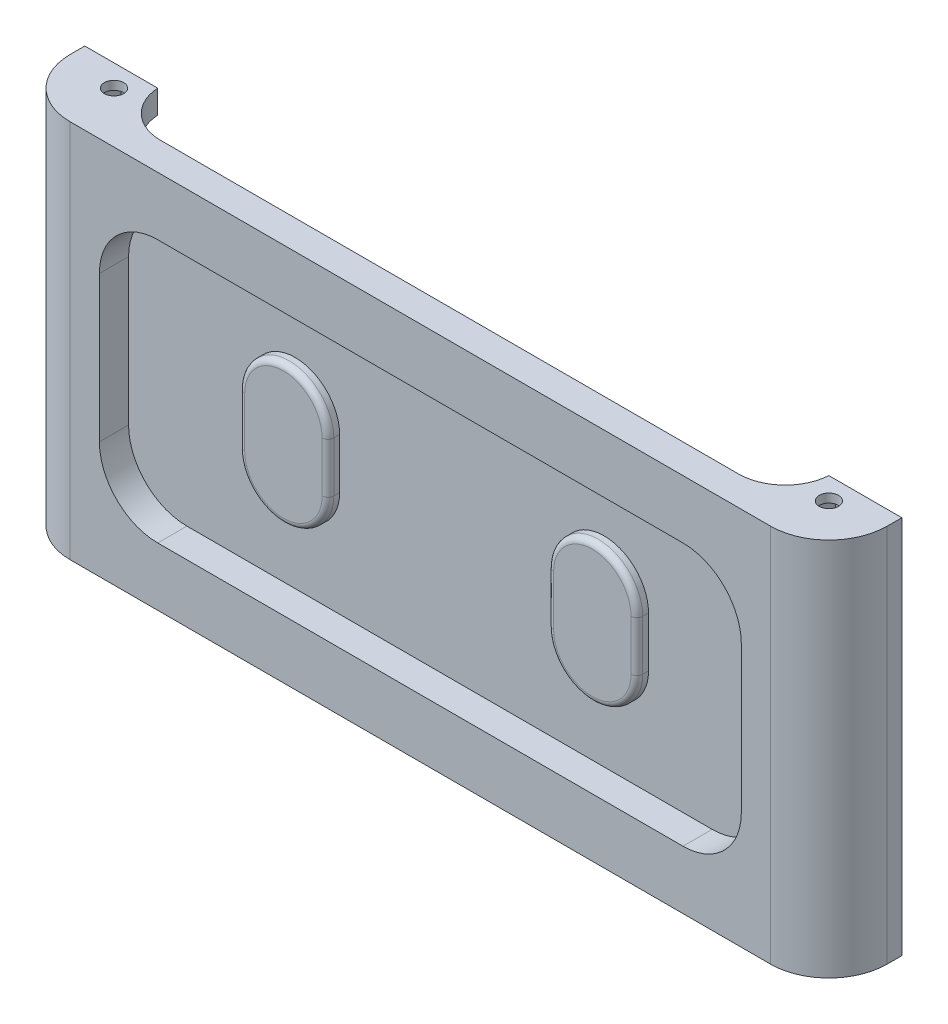
from build123d import *

# Parameters (mm, degrees)
SKETCH1_W             = 140
SKETCH1_H             = 65
BOSS_EXTRUDE1_DEPTH   = 12.5
SKETCH4_W             = 130
SKETCH4_H             = 7.5
CUT_EXTRUDE3_DEPTH    = 155.858806659
SKETCH2_W             = 110
SKETCH2_H             = 45
CUT_EXTRUDE1_DEPTH    = 155.858806659
FILLET1_R             = 10
FILLET2_R             = 10
SKETCH5_W             = 7.5
SKETCH5_H             = 7.5
BOSS_EXTRUDE2_DEPTH   = 4
SKETCH6_2_R           = 1.65
CUT_EXTRUDE5_DEPTH    = 154.222876882
SKETCH6_R             = 1.65
CUT_EXTRUDE4_DEPTH    = 2.5
FILLET3_R             = 8
MIRROR1_START         = 61
MIRROR1_DEPTH         = 4
MIRROR1_START_2       = 63.5
MIRROR1_2_OUTLINE_R   = 1.65
MIRROR1_2_DEPTH       = 1.5
SKETCH7_W             = 130
SKETCH7_H             = 57
BOSS_EXTRUDE3_DEPTH   = 1
BOSS_EXTRUDE4_DEPTH   = 2
BOSS_EXTRUDE4_2_DEPTH = 2
SKETCH9_R             = 8.4
BOSS_EXTRUDE6_DEPTH   = 10
BOSS_EXTRUDE6_2_DEPTH = 10
CHAMFER1_SIZE         = 3
FILLET5_R             = 1
FILLET6_R             = 1
FILLET7_R             = 1


# Read off the part's stored shape, not the designer's step: Mirror1
with BuildPart() as part:
    # Sketch1 → Boss-Extrude1 (new body)
    with BuildSketch(Plane.XY):
        with Locations((70, 32.5)):
            Rectangle(SKETCH1_W, SKETCH1_H)
    extrude(amount=BOSS_EXTRUDE1_DEPTH)

    # Sketch4 → Cut-Extrude3 (cut, through all)
    with BuildSketch(Plane(origin=(0, 65, 0), x_dir=(1, 0, 0), z_dir=(0, 1, 0))):
        with Locations((70, -3.75)):
            Rectangle(SKETCH4_W, SKETCH4_H)
    extrude(amount=-CUT_EXTRUDE3_DEPTH, mode=Mode.SUBTRACT)

    # Sketch2 → Cut-Extrude1 (cut, through all)
    with BuildSketch(Plane.XY.offset(12.5)):
        with Locations((70, 32.5)):
            Rectangle(SKETCH2_W, SKETCH2_H)
    extrude(amount=-CUT_EXTRUDE1_DEPTH, mode=Mode.SUBTRACT)

    # Fillet1
    fillet1_edges = [part.edges().sort_by_distance(p)[0] for p in [
        (125, 55, 10),
        (125, 10, 10),
        (15, 10, 10),
        (15, 55, 10),
    ]]
    fillet(fillet1_edges, radius=FILLET1_R)

    # Fillet2
    fillet2_edges = [part.edges().sort_by_distance(p)[0] for p in [
        (140, 32.5, 12.5),
        (0, 32.5, 12.5),
    ]]
    fillet(fillet2_edges, radius=FILLET2_R)

    # Sketch5 → Boss-Extrude2 (add)
    with BuildSketch(Plane.XZ):
        with Locations((8.75, 3.75)):
            Rectangle(SKETCH5_W, SKETCH5_H)
        with Locations((131.25, 3.75)):
            Rectangle(SKETCH5_W, SKETCH5_H)
    extrude(amount=-BOSS_EXTRUDE2_DEPTH)

    # Sketch6<2> → Cut-Extrude5 (cut, through all)
    with BuildSketch(Plane(origin=(0, 4, 0), x_dir=(1, 0, 0), z_dir=(0, 1, 0))):
        with Locations(Location((8.75, -3.75, 0), (0, 0, 270))):
            Circle(SKETCH6_2_R)
        with Locations(Location((131.25, -3.75, 0), (0, 0, 270))):
            Circle(SKETCH6_2_R)
    extrude(amount=-CUT_EXTRUDE5_DEPTH, mode=Mode.SUBTRACT)

    # Sketch6 → Cut-Extrude4 (cut)
    # profile 1 of 2: a face of its own
    with BuildSketch(Plane(origin=(0, 4, 0), x_dir=(1, 0, 0), z_dir=(0, 1, 0))):
        Polygon((11.925426481, -3.75), (10.33771324, -1), (7.16228676, -1), (5.574573519, -3.75), (7.16228676, -6.5), (10.33771324, -6.5), align=None)
        with Locations(Location((8.75, -3.75, 0), (0, 0, 270))):
            Circle(SKETCH6_R, mode=Mode.SUBTRACT)
    # profile 2 of 2: a face of its own
    with BuildSketch(Plane(origin=(0, 4, 0), x_dir=(1, 0, 0), z_dir=(0, 1, 0))):
        Polygon((134.425426481, -3.75), (132.83771324, -6.5), (129.66228676, -6.5), (128.074573519, -3.75), (129.66228676, -1), (132.83771324, -1), align=None)
        with Locations(Location((131.25, -3.75, 0), (0, 0, 270))):
            Circle(SKETCH6_R, mode=Mode.SUBTRACT)
    extrude(amount=-CUT_EXTRUDE4_DEPTH, mode=Mode.SUBTRACT)

    # Fillet3
    # the kernel refuses this fillet: 8 mm, written as the material it adds along each edge
    with BuildSketch(Plane(origin=(127.5, 0, 7.5), x_dir=(-1, 0, 0), z_dir=(0, 1, 0))) as fillet3_piece_1:
        with BuildLine():
            CenterArc((7.984359711, -8), FILLET3_R, 90, 86.416678302)
            Line((0, -7.5), (0, 0))
            Line((0, 0), (7.984359711, 0))
        make_face()
    extrude(amount=4)
    with BuildSketch(Plane(origin=(12.5, 0, 7.5), x_dir=(1, 0, 0), z_dir=(0, 1, 0))) as fillet3_piece_2:
        with BuildLine():
            CenterArc((7.984359711, 8), FILLET3_R, 183.583321698, 86.416678302)
            Line((0, 7.5), (0, 0))
            Line((0, 0), (7.984359711, 0))
        make_face()
    extrude(amount=4)

    # Mirror1 outline → Mirror1 (add)
    # profile 1 of 2: a face of its own
    with BuildSketch(Plane(origin=(0, 0, 0), x_dir=(1, 0, 0), z_dir=(0, 1, 0)).offset(MIRROR1_START)):
        with BuildLine():
            Line((135, -7.5), (135, 0))
            Line((135, 0), (127.5, 0))
            ThreePointArc((127.5, 0), (124.992865864, -5.330951895), (119.515640289, -7.5))
            Line((119.515640289, -7.5), (135, -7.5))
        make_face()
        Polygon((134.425426481, -3.75), (132.83771324, -6.5), (129.66228676, -6.5), (128.074573519, -3.75), (129.66228676, -1), (132.83771324, -1), align=None, mode=Mode.SUBTRACT)
    # profile 2 of 2: a face of its own
    with BuildSketch(Plane(origin=(0, 0, 0), x_dir=(1, 0, 0), z_dir=(0, 1, 0)).offset(MIRROR1_START)):
        with BuildLine():
            Line((5, -7.5), (20.484359711, -7.5))
            ThreePointArc((20.484359711, -7.5), (15.007134136, -5.330951895), (12.5, 0))
            Line((12.5, 0), (5, 0))
            Line((5, 0), (5, -7.5))
        make_face()
        Polygon((10.33771324, -1), (11.925426481, -3.75), (10.33771324, -6.5), (7.16228676, -6.5), (5.574573519, -3.75), (7.16228676, -1), align=None, mode=Mode.SUBTRACT)
    extrude(amount=MIRROR1_DEPTH)

    # Mirror1 2 outline → Mirror1 2 (add)
    # profile 1 of 2: a face of its own
    with BuildSketch(Plane(origin=(0, 0, 0), x_dir=(1, 0, 0), z_dir=(0, 1, 0)).offset(MIRROR1_START_2)):
        Polygon((10.33771324, -6.5), (11.925426481, -3.75), (10.33771324, -1), (7.16228676, -1), (5.574573519, -3.75), (7.16228676, -6.5), align=None)
        with Locations((8.75, -3.75)):
            Circle(MIRROR1_2_OUTLINE_R, mode=Mode.SUBTRACT)
    # profile 2 of 2: a face of its own
    with BuildSketch(Plane(origin=(0, 0, 0), x_dir=(1, 0, 0), z_dir=(0, 1, 0)).offset(MIRROR1_START_2)):
        Polygon((129.66228676, -6.5), (132.83771324, -6.5), (134.425426481, -3.75), (132.83771324, -1), (129.66228676, -1), (128.074573519, -3.75), align=None)
        with Locations((131.25, -3.75)):
            Circle(MIRROR1_2_OUTLINE_R, mode=Mode.SUBTRACT)
    extrude(amount=MIRROR1_2_DEPTH)


with BuildPart() as body_2:
    # Sketch7 → Boss-Extrude3 (new body)
    with BuildSketch(Plane(origin=(0, 0, 7.5), x_dir=(-1, 0, 0), z_dir=(0, 0, -1))):
        with Locations((-70, 32.5)):
            Rectangle(SKETCH7_W, SKETCH7_H)
    extrude(amount=BOSS_EXTRUDE3_DEPTH)


with BuildPart() as body_3:
    # Sketch8 → Boss-Extrude4 (new body)
    with BuildSketch(Plane.XY.offset(7.5)):
        with BuildLine():
            Line((35.901012383, 36.668605192), (35.901012383, 28.066721462))
            ThreePointArc((35.901012383, 28.066721462), (43.532665447, 20.435068399), (51.16431851, 28.066721462))
            Line((51.16431851, 28.066721462), (51.16431851, 36.668605192))
            ThreePointArc((51.16431851, 36.668605192), (43.532665447, 44.300258256), (35.901012383, 36.668605192))
        make_face()
    extrude(amount=BOSS_EXTRUDE4_DEPTH)

    # Fillet7
    fillet7_edges = [body_3.edges().sort_by_distance(p)[0] for p in [
        (43.532665447, 20.435068399, 9.5),
        (51.16431851, 32.367663327, 9.5),
        (43.532665447, 44.300258256, 9.5),
        (35.901012383, 32.367663327, 9.5),
    ]]
    fillet(fillet7_edges, radius=FILLET7_R)


with BuildPart() as body_4:
    # Sketch8 → Boss-Extrude4 2 (new body)
    with BuildSketch(Plane.XY.offset(7.5)):
        with BuildLine():
            Line((88.83568149, 36.668605192), (88.83568149, 28.066721462))
            ThreePointArc((88.83568149, 28.066721462), (96.467334553, 20.435068399), (104.098987617, 28.066721462))
            Line((104.098987617, 28.066721462), (104.098987617, 36.668605192))
            ThreePointArc((104.098987617, 36.668605192), (96.467334553, 44.300258256), (88.83568149, 36.668605192))
        make_face()
    extrude(amount=BOSS_EXTRUDE4_2_DEPTH)

    # Fillet6
    fillet6_edges = [body_4.edges().sort_by_distance(p)[0] for p in [
        (96.467334553, 20.435068399, 9.5),
        (104.098987617, 32.367663327, 9.5),
        (96.467334553, 44.300258256, 9.5),
        (88.83568149, 32.367663327, 9.5),
    ]]
    fillet(fillet6_edges, radius=FILLET6_R)


with BuildPart() as body_5:
    # Sketch9 → Boss-Extrude6 (new body)
    with BuildSketch(Plane(origin=(0, 0, 6.5), x_dir=(-1, 0, 0), z_dir=(0, 0, -1))):
        with Locations((-19, 42.7)):
            Circle(SKETCH9_R)
    extrude(amount=BOSS_EXTRUDE6_DEPTH)


with BuildPart() as body_6:
    # Sketch9 → Boss-Extrude6 2 (new body)
    with BuildSketch(Plane(origin=(0, 0, 6.5), x_dir=(-1, 0, 0), z_dir=(0, 0, -1))):
        with Locations(Location((-121, 42.7, 0), (0, 0, 180))):
            Circle(SKETCH9_R)
    extrude(amount=BOSS_EXTRUDE6_2_DEPTH)

    # Combine1: union body 2, body 5
    add(body_2.part)
    add(body_5.part)

    # Chamfer1
    chamfer1_edges = [body_6.edges().sort_by_distance(p)[0] for p in [
        (112.6, 42.7, 6.5),
        (27.4, 42.7, 6.5),
    ]]
    chamfer(chamfer1_edges, length=CHAMFER1_SIZE)

    # Fillet5
    fillet5_edges = [body_6.edges().sort_by_distance(p)[0] for p in [
        (112.6, 42.7, -3.5),
        (27.4, 42.7, -3.5),
    ]]
    fillet(fillet5_edges, radius=FILLET5_R)


solid = Compound([part.part, body_3.part, body_4.part, body_6.part])
